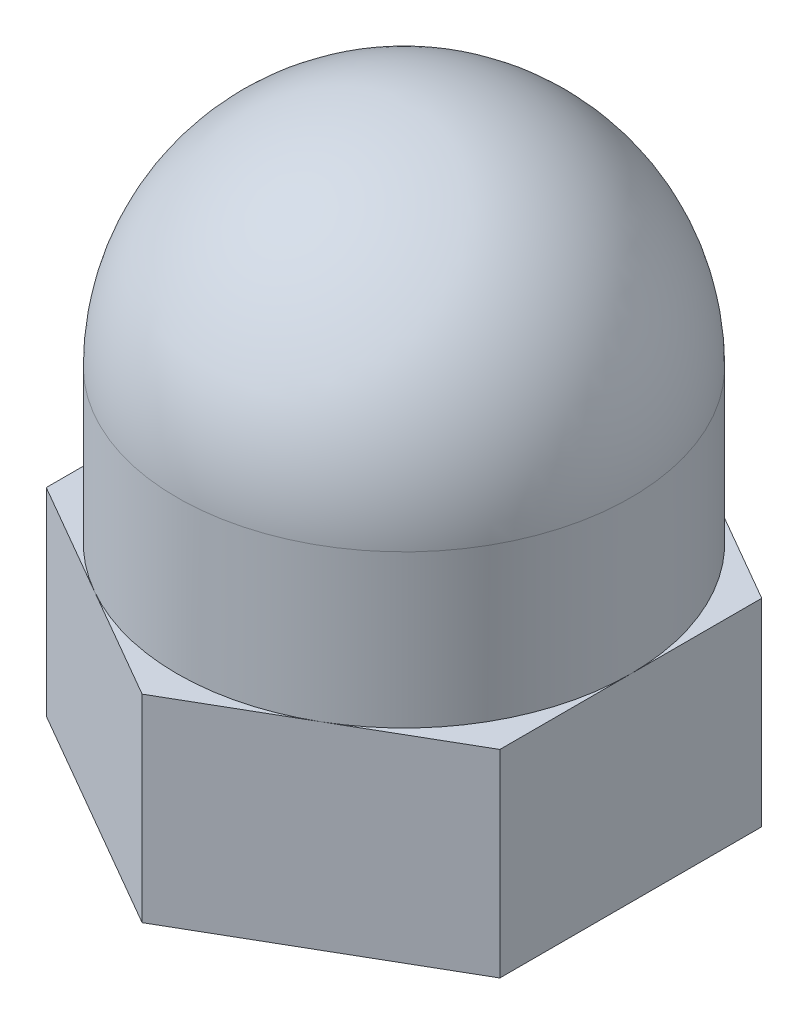
from build123d import *

# Parameters (mm, degrees)
SZKIC1_R                    = 1.5
DODANIE_WYCI_GNI_CIE1_DEPTH = 2.4


with BuildPart() as part:
    # Szkic1 → Dodanie-wyciągnięcie1 (new body)
    with BuildSketch(Plane(origin=(0, 0, 0), x_dir=(1, 0, 0), z_dir=(0, 1, 0))):
        Polygon((0, 3.175426481), (-2.75, 1.58771324), (-2.75, -1.58771324), (0, -3.175426481), (2.75, -1.58771324), (2.75, 1.58771324), align=None)
        Circle(SZKIC1_R, mode=Mode.SUBTRACT)
    extrude(amount=DODANIE_WYCI_GNI_CIE1_DEPTH)

    # Szkic3 → Obrót2 (revolve)
    with BuildSketch(Plane.XY):
        with BuildLine():
            Line((0, 7), (0, 2.4))
            Line((0, 2.4), (2.75, 2.4))
            Line((2.75, 2.4), (2.75, 4.25))
            ThreePointArc((2.75, 4.25), (1.944543648, 6.194543648), (0, 7))
        make_face()
    revolve(axis=Axis((0, 7, 0), (0, -1, 0)))


solid = part.part
